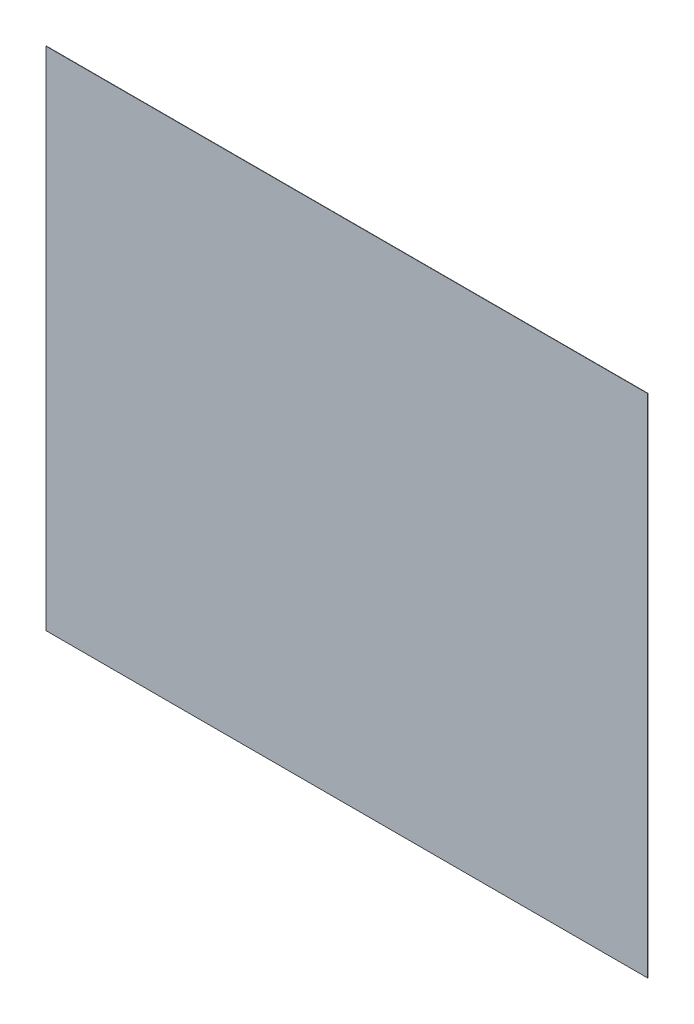
from build123d import *

# Parameters (mm, degrees)
SKETCH1_W           = 1931
SKETCH1_H           = 1625
BOSS_EXTRUDE1_DEPTH = 1


with BuildPart() as part:
    # Sketch1 → Boss-Extrude1 (new body)
    with BuildSketch(Plane.XY):
        with Locations((965.5, 812.5)):
            Rectangle(SKETCH1_W, SKETCH1_H)
    extrude(amount=BOSS_EXTRUDE1_DEPTH)


solid = part.part
